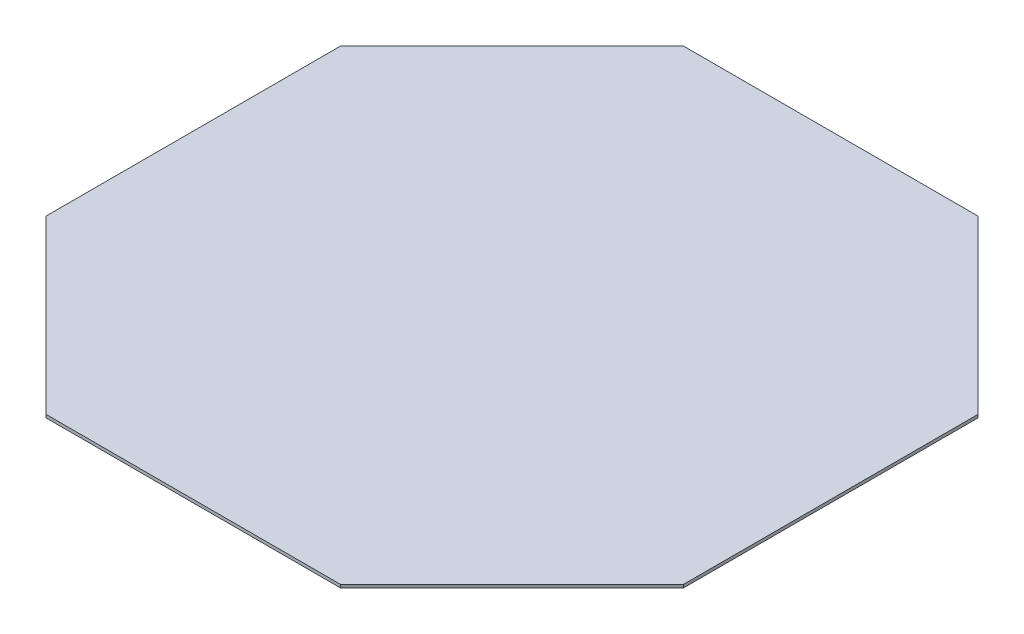
from build123d import *

# Parameters (mm, degrees)
BOSS_EXTRUDE1_DEPTH = 3.175


with BuildPart() as part:
    # Sketch1 → Boss-Extrude1 (new body)
    with BuildSketch(Plane(origin=(0, 0, 0), x_dir=(1, 0, 0), z_dir=(0, 1, 0))):
        Polygon((177.8, 660.4), (0, 482.6), (0, 177.8), (177.8, 0), (482.6, 0), (660.4, 177.8), (660.4, 482.6), (482.6, 660.4), align=None)
    extrude(amount=BOSS_EXTRUDE1_DEPTH)


solid = part.part
